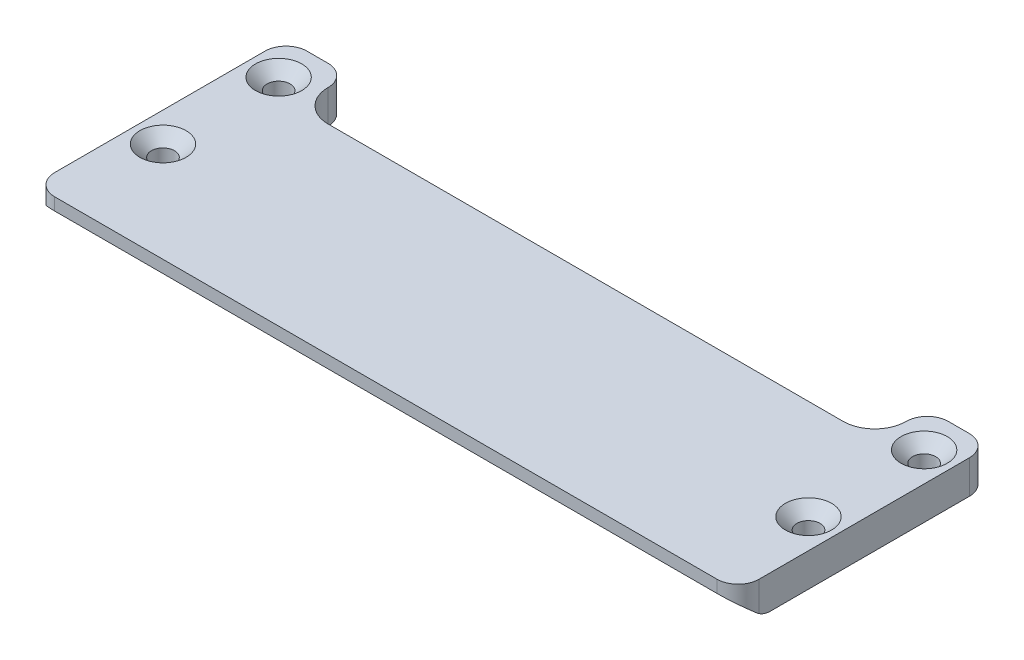
from build123d import *

# Parameters (mm, degrees)
SKETCH1_W                                       = 67
SKETCH1_H                                       = 24
BOSS_EXTRUDE1_DEPTH                             = 3.175
CSK_FOR_M2_FLAT_HEAD_MACHINE_SCREW1_D           = 2.2
CSK_FOR_M2_FLAT_HEAD_MACHINE_SCREW1_CSINK_D     = 4.4
CSK_FOR_M2_FLAT_HEAD_MACHINE_SCREW1_CSINK_ANGLE = 90
CHAMFER1_SIZE                                   = 2
CHAMFER1_SIZE2                                  = 2.383507185
SKETCH4_W                                       = 55
SKETCH4_H                                       = 10
CUT_EXTRUDE1_DEPTH                              = 36.725769761
FILLET2_R                                       = 2
FILLET4_R                                       = 3
FILLET5_R                                       = 2


with BuildPart() as part:
    # Sketch1 → Boss-Extrude1 (new body)
    with BuildSketch(Plane(origin=(0, 0, 0), x_dir=(1, 0, 0), z_dir=(0, 1, 0))):
        Rectangle(SKETCH1_W, SKETCH1_H)
    extrude(amount=BOSS_EXTRUDE1_DEPTH)

    # CSK for M2 Flat Head Machine Screw1 (through all)
    with Locations(Plane(origin=(0, 3.175, 0), x_dir=(1, 0, 0), z_dir=(0, 1, 0))):
        with Locations((-30.7, 8.5), (-30.7, -2.5), (30.7, -2.5), (30.7, 8.5)):
            CounterSinkHole(CSK_FOR_M2_FLAT_HEAD_MACHINE_SCREW1_D / 2, CSK_FOR_M2_FLAT_HEAD_MACHINE_SCREW1_CSINK_D / 2, counter_sink_angle=CSK_FOR_M2_FLAT_HEAD_MACHINE_SCREW1_CSINK_ANGLE)

    # Chamfer1
    chamfer1_edges = [part.edges().sort_by_distance(p)[0] for p in [
        (0, 0, 12),
    ]]
    chamfer1_side = [part.faces().sort_by_distance(p)[0] for p in [
        (0, 1.5875, 12),
    ]]
    chamfer(chamfer1_edges, length=CHAMFER1_SIZE, length2=CHAMFER1_SIZE2, reference=chamfer1_side[0])

    # Sketch4 → Cut-Extrude1 (cut, through all)
    with BuildSketch(Plane(origin=(0, 3.175, 0), x_dir=(1, 0, 0), z_dir=(0, 1, 0))):
        with Locations((0, 12)):
            Rectangle(SKETCH4_W, SKETCH4_H)
    extrude(amount=-CUT_EXTRUDE1_DEPTH, mode=Mode.SUBTRACT)

    # Fillet2
    fillet2_edges = [part.edges().sort_by_distance(p)[0] for p in [
        (0, 0, 9.616492815),
    ]]
    fillet(fillet2_edges, radius=FILLET2_R)

    # Fillet4
    fillet4_edges = [part.edges().sort_by_distance(p)[0] for p in [
        (-27.5, 1.5875, -7),
        (27.5, 1.5875, -7),
    ]]
    fillet(fillet4_edges, radius=FILLET4_R)

    # Fillet5
    fillet5_edges = [part.edges().sort_by_distance(p)[0] for p in [
        (33.5, 1.5875, -12),
        (33.5, 2.5875, 12),
        (-33.5, 2.5875, 12),
        (-27.5, 1.5875, -12),
        (27.5, 1.5875, -12),
        (-33.5, 1.5875, -12),
    ]]
    fillet(fillet5_edges, radius=FILLET5_R - 0.0001)  # a hair under: the kernel refuses the full size


solid = part.part
